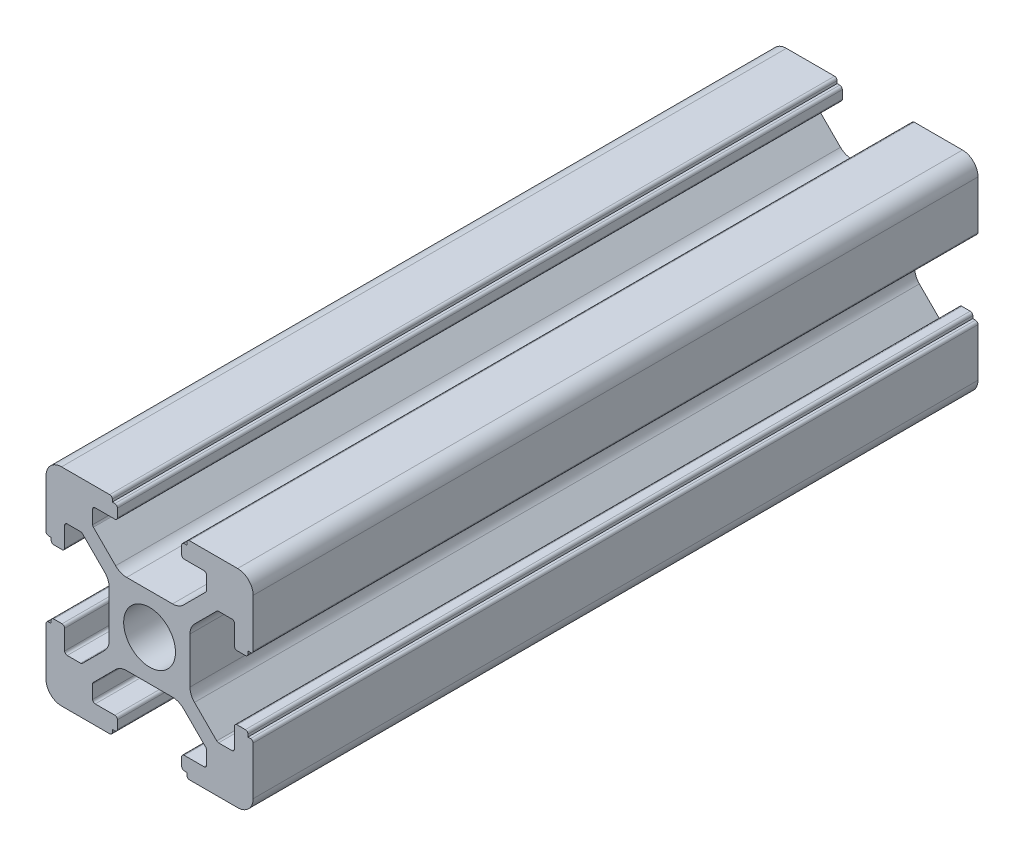
from build123d import *

# Parameters (mm, degrees)
SKETCH_1_R      = 2.5
EXTRUDE_1_DEPTH = 70


with BuildPart() as part:
    # 草图1 → 凸台-拉伸1 (new body)
    with BuildSketch(Plane.XY):
        with BuildLine():
            ThreePointArc((-10.002261885, -8.502261885), (-9.562922057, -9.562922057), (-8.502261885, -10.002261885))
            Line((-8.502261885, -10.002261885), (-3.85, -10.002261885))
            ThreePointArc((-3.85, -10.002261885), (-3.673223305, -9.929038581), (-3.6, -9.752261885))
            Line((-3.6, -9.752261885), (-3.6, -9.502261885))
            Line((-3.6, -9.502261885), (-3.35, -9.502261885))
            ThreePointArc((-3.35, -9.502261885), (-3.173223305, -9.429038581), (-3.1, -9.252261885))
            Line((-3.1, -9.252261885), (-3.1, -8.45))
            ThreePointArc((-3.1, -8.45), (-3.173223305, -8.273223305), (-3.35, -8.2))
            Line((-3.35, -8.2), (-5.25, -8.2))
            ThreePointArc((-5.25, -8.2), (-5.426776695, -8.126776695), (-5.5, -7.95))
            Line((-5.5, -7.95), (-5.5, -6.664213562))
            ThreePointArc((-5.5, -6.664213562), (-5.480969883, -6.568542704), (-5.426776695, -6.487436867))
            Line((-5.426776695, -6.487436867), (-3.278679656, -4.339339828))
            ThreePointArc((-3.278679656, -4.339339828), (-2.792044633, -4.014180701), (-2.218019485, -3.9))
            Line((-2.218019485, -3.9), (2.218019485, -3.9))
            ThreePointArc((2.218019485, -3.9), (2.792044633, -4.014180701), (3.278679656, -4.339339828))
            Line((3.278679656, -4.339339828), (5.426776695, -6.487436867))
            ThreePointArc((5.426776695, -6.487436867), (5.480969883, -6.568542704), (5.5, -6.664213562))
            Line((5.5, -6.664213562), (5.5, -7.95))
            ThreePointArc((5.5, -7.95), (5.426776695, -8.126776695), (5.25, -8.2))
            Line((5.25, -8.2), (3.35, -8.2))
            ThreePointArc((3.35, -8.2), (3.173223305, -8.273223305), (3.1, -8.45))
            Line((3.1, -8.45), (3.1, -9.252261885))
            ThreePointArc((3.1, -9.252261885), (3.173223305, -9.429038581), (3.35, -9.502261885))
            Line((3.35, -9.502261885), (3.6, -9.502261885))
            Line((3.6, -9.502261885), (3.6, -9.752261885))
            ThreePointArc((3.6, -9.752261885), (3.673223305, -9.929038581), (3.85, -10.002261885))
            Line((3.85, -10.002261885), (8.502261885, -10.002261885))
            ThreePointArc((8.502261885, -10.002261885), (9.562922057, -9.562922057), (10.002261885, -8.502261885))
            Line((10.002261885, -8.502261885), (10.002261885, -3.85))
            ThreePointArc((10.002261885, -3.85), (9.929038581, -3.673223305), (9.752261885, -3.6))
            Line((9.752261885, -3.6), (9.502261885, -3.6))
            Line((9.502261885, -3.6), (9.502261885, -3.35))
            ThreePointArc((9.502261885, -3.35), (9.429038581, -3.173223305), (9.252261885, -3.1))
            Line((9.252261885, -3.1), (8.45, -3.1))
            ThreePointArc((8.45, -3.1), (8.273223305, -3.173223305), (8.2, -3.35))
            Line((8.2, -3.35), (8.2, -5.25))
            ThreePointArc((8.2, -5.25), (8.126776695, -5.426776695), (7.95, -5.5))
            Line((7.95, -5.5), (6.664213562, -5.5))
            ThreePointArc((6.664213562, -5.5), (6.568542704, -5.480969883), (6.487436867, -5.426776695))
            Line((6.487436867, -5.426776695), (4.339339828, -3.278679656))
            ThreePointArc((4.339339828, -3.278679656), (4.014180701, -2.792044633), (3.9, -2.218019485))
            Line((3.9, -2.218019485), (3.9, 2.218019485))
            ThreePointArc((3.9, 2.218019485), (4.014180701, 2.792044633), (4.339339828, 3.278679656))
            Line((4.339339828, 3.278679656), (6.487436867, 5.426776695))
            ThreePointArc((6.487436867, 5.426776695), (6.568542704, 5.480969883), (6.664213562, 5.5))
            Line((6.664213562, 5.5), (7.95, 5.5))
            ThreePointArc((7.95, 5.5), (8.126776695, 5.426776695), (8.2, 5.25))
            Line((8.2, 5.25), (8.2, 3.35))
            ThreePointArc((8.2, 3.35), (8.273223305, 3.173223305), (8.45, 3.1))
            Line((8.45, 3.1), (9.252261885, 3.1))
            ThreePointArc((9.252261885, 3.1), (9.429038581, 3.173223305), (9.502261885, 3.35))
            Line((9.502261885, 3.35), (9.502261885, 3.6))
            Line((9.502261885, 3.6), (9.752261885, 3.6))
            ThreePointArc((9.752261885, 3.6), (9.929038581, 3.673223305), (10.002261885, 3.85))
            Line((10.002261885, 3.85), (10.002261885, 8.502261885))
            ThreePointArc((10.002261885, 8.502261885), (9.562922057, 9.562922057), (8.502261885, 10.002261885))
            Line((8.502261885, 10.002261885), (3.85, 10.002261885))
            ThreePointArc((3.85, 10.002261885), (3.673223305, 9.929038581), (3.6, 9.752261885))
            Line((3.6, 9.752261885), (3.6, 9.502261885))
            Line((3.6, 9.502261885), (3.35, 9.502261885))
            ThreePointArc((3.35, 9.502261885), (3.173223305, 9.429038581), (3.1, 9.252261885))
            Line((3.1, 9.252261885), (3.1, 8.45))
            ThreePointArc((3.1, 8.45), (3.173223305, 8.273223305), (3.35, 8.2))
            Line((3.35, 8.2), (5.25, 8.2))
            ThreePointArc((5.25, 8.2), (5.426776695, 8.126776695), (5.5, 7.95))
            Line((5.5, 7.95), (5.5, 6.664213562))
            ThreePointArc((5.5, 6.664213562), (5.480969883, 6.568542704), (5.426776695, 6.487436867))
            Line((5.426776695, 6.487436867), (3.278679656, 4.339339828))
            ThreePointArc((3.278679656, 4.339339828), (2.792044633, 4.014180701), (2.218019485, 3.9))
            Line((2.218019485, 3.9), (-2.218019485, 3.9))
            ThreePointArc((-2.218019485, 3.9), (-2.792044633, 4.014180701), (-3.278679656, 4.339339828))
            Line((-3.278679656, 4.339339828), (-5.426776695, 6.487436867))
            ThreePointArc((-5.426776695, 6.487436867), (-5.480969883, 6.568542704), (-5.5, 6.664213562))
            Line((-5.5, 6.664213562), (-5.5, 7.95))
            ThreePointArc((-5.5, 7.95), (-5.426776695, 8.126776695), (-5.25, 8.2))
            Line((-5.25, 8.2), (-3.35, 8.2))
            ThreePointArc((-3.35, 8.2), (-3.173223305, 8.273223305), (-3.1, 8.45))
            Line((-3.1, 8.45), (-3.1, 9.252261885))
            ThreePointArc((-3.1, 9.252261885), (-3.173223305, 9.429038581), (-3.35, 9.502261885))
            Line((-3.35, 9.502261885), (-3.6, 9.502261885))
            Line((-3.6, 9.502261885), (-3.6, 9.752261885))
            ThreePointArc((-3.6, 9.752261885), (-3.673223305, 9.929038581), (-3.85, 10.002261885))
            Line((-3.85, 10.002261885), (-8.502261885, 10.002261885))
            ThreePointArc((-8.502261885, 10.002261885), (-9.562922057, 9.562922057), (-10.002261885, 8.502261885))
            Line((-10.002261885, 8.502261885), (-10.002261885, 3.85))
            ThreePointArc((-10.002261885, 3.85), (-9.929038581, 3.673223305), (-9.752261885, 3.6))
            Line((-9.752261885, 3.6), (-9.502261885, 3.6))
            Line((-9.502261885, 3.6), (-9.502261885, 3.35))
            ThreePointArc((-9.502261885, 3.35), (-9.429038581, 3.173223305), (-9.252261885, 3.1))
            Line((-9.252261885, 3.1), (-8.45, 3.1))
            ThreePointArc((-8.45, 3.1), (-8.273223305, 3.173223305), (-8.2, 3.35))
            Line((-8.2, 3.35), (-8.2, 5.25))
            ThreePointArc((-8.2, 5.25), (-8.126776695, 5.426776695), (-7.95, 5.5))
            Line((-7.95, 5.5), (-6.664213562, 5.5))
            ThreePointArc((-6.664213562, 5.5), (-6.568542704, 5.480969883), (-6.487436867, 5.426776695))
            Line((-6.487436867, 5.426776695), (-4.339339828, 3.278679656))
            ThreePointArc((-4.339339828, 3.278679656), (-4.014180701, 2.792044633), (-3.9, 2.218019485))
            Line((-3.9, 2.218019485), (-3.9, -2.218019485))
            ThreePointArc((-3.9, -2.218019485), (-4.014180701, -2.792044633), (-4.339339828, -3.278679656))
            Line((-4.339339828, -3.278679656), (-6.487436867, -5.426776695))
            ThreePointArc((-6.487436867, -5.426776695), (-6.568542704, -5.480969883), (-6.664213562, -5.5))
            Line((-6.664213562, -5.5), (-7.95, -5.5))
            ThreePointArc((-7.95, -5.5), (-8.126776695, -5.426776695), (-8.2, -5.25))
            Line((-8.2, -5.25), (-8.2, -3.35))
            ThreePointArc((-8.2, -3.35), (-8.273223305, -3.173223305), (-8.45, -3.1))
            Line((-8.45, -3.1), (-9.252261885, -3.1))
            ThreePointArc((-9.252261885, -3.1), (-9.429038581, -3.173223305), (-9.502261885, -3.35))
            Line((-9.502261885, -3.35), (-9.502261885, -3.6))
            Line((-9.502261885, -3.6), (-9.752261885, -3.6))
            ThreePointArc((-9.752261885, -3.6), (-9.929038581, -3.673223305), (-10.002261885, -3.85))
            Line((-10.002261885, -3.85), (-10.002261885, -8.502261885))
        make_face()
        Circle(SKETCH_1_R, mode=Mode.SUBTRACT)
    extrude(amount=EXTRUDE_1_DEPTH)


solid = part.part
